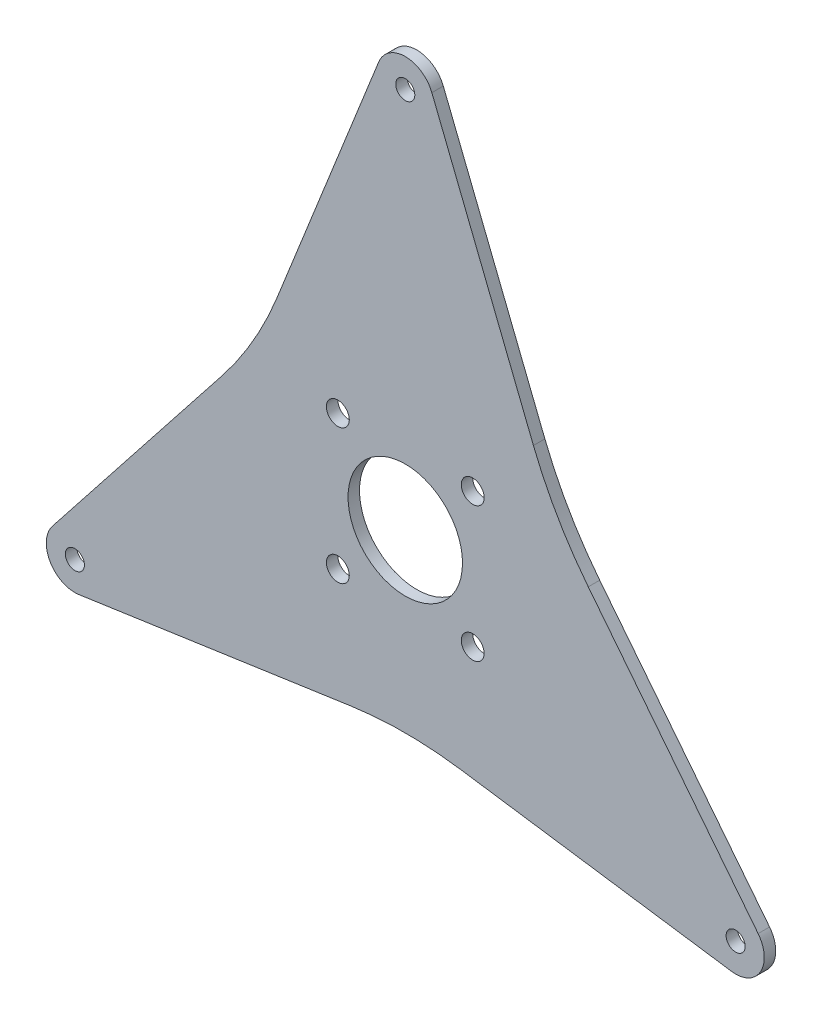
from build123d import *

# Parameters (mm, degrees)
SKETCH1_R           = 5
SKETCH1_R_2         = 6
SKETCH1_R_3         = 30
BOSS_EXTRUDE1_DEPTH = 6


with BuildPart() as part:
    # Sketch1 → Boss-Extrude1 (new body)
    with BuildSketch(Plane.XY):
        with BuildLine():
            Line((-184.982531492, -90.710669875), (-95.932164607, 22.19158409))
            ThreePointArc((-95.932164607, 22.19158409), (-79.759760322, 46.049319093), (-67.184557876, 71.983899545))
            Line((-67.184557876, 71.983899545), (-13.93352124, 205.554906466))
            ThreePointArc((-13.93352124, 205.554906466), (0, 215), (13.93352124, 205.554906466))
            Line((13.93352124, 205.554906466), (67.184557876, 71.983899545))
            ThreePointArc((67.184557876, 71.983899545), (79.759760322, 46.049319093), (95.932164607, 22.19158409))
            Line((95.932164607, 22.19158409), (184.982531492, -90.710669875))
            ThreePointArc((184.982531492, -90.710669875), (186.195461814, -107.5), (171.049010252, -114.844236591))
            Line((171.049010252, -114.844236591), (28.747606732, -94.175483635))
            ThreePointArc((28.747606732, -94.175483635), (0, -92.098638185), (-28.747606732, -94.175483635))
            Line((-28.747606732, -94.175483635), (-171.049010252, -114.844236591))
            ThreePointArc((-171.049010252, -114.844236591), (-186.195461814, -107.5), (-184.982531492, -90.710669875))
        make_face()
        with Locations((0, 200)):
            Circle(SKETCH1_R, mode=Mode.SUBTRACT)
        with Locations((173.205080757, -100)):
            Circle(SKETCH1_R, mode=Mode.SUBTRACT)
        with Locations((-173.205080757, -100)):
            Circle(SKETCH1_R, mode=Mode.SUBTRACT)
        with Locations((-35.355339059, 35.355339059)):
            Circle(SKETCH1_R_2, mode=Mode.SUBTRACT)
        with Locations((35.355339059, 35.355339059)):
            Circle(SKETCH1_R_2, mode=Mode.SUBTRACT)
        with Locations((35.355339059, -35.355339059)):
            Circle(SKETCH1_R_2, mode=Mode.SUBTRACT)
        with Locations((-35.355339059, -35.355339059)):
            Circle(SKETCH1_R_2, mode=Mode.SUBTRACT)
        Circle(SKETCH1_R_3, mode=Mode.SUBTRACT)
    extrude(amount=BOSS_EXTRUDE1_DEPTH)


solid = part.part
